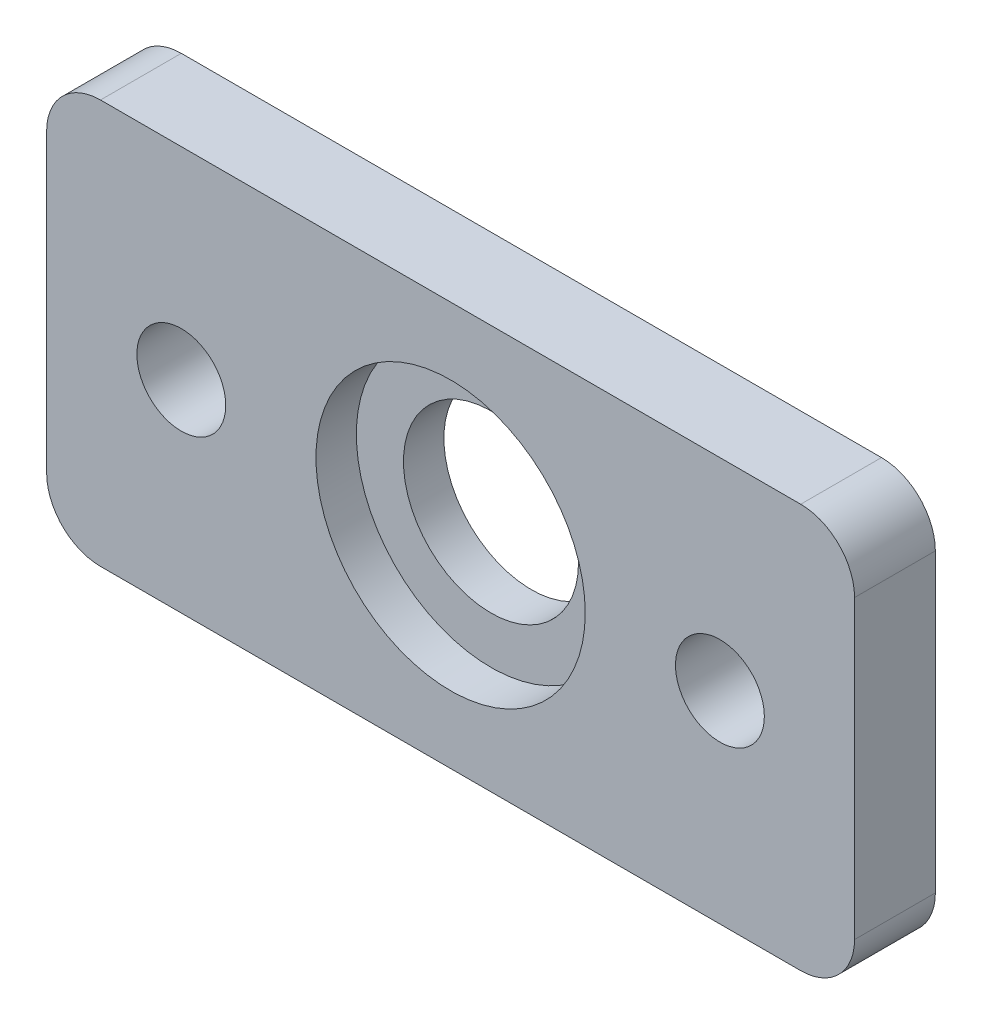
from build123d import *

# Parameters (mm, degrees)
EXTRUDE_1_DEPTH     = 3
SKETCH_2_R          = 5
CUT_EXTRUDE_1_DEPTH = 1.5
SKETCH_3_R          = 3.25
CUT_EXTRUDE_2_DEPTH = 34.674916481
SKETCH_4_R          = 1.65
CUT_EXTRUDE_3_DEPTH = 34.674916481


with BuildPart() as part:
    # Эскиз1 → Бобышка-Вытянуть1 (new body)
    with BuildSketch(Plane.XY):
        with BuildLine():
            Line((2, 0), (28, 0))
            ThreePointArc((28, 0), (29.414213562, 0.585786438), (30, 2))
            Line((30, 2), (30, 13))
            ThreePointArc((30, 13), (29.414213562, 14.414213562), (28, 15))
            Line((28, 15), (2, 15))
            ThreePointArc((2, 15), (0.585786438, 14.414213562), (0, 13))
            Line((0, 13), (0, 2))
            ThreePointArc((0, 2), (0.585786438, 0.585786438), (2, 0))
        make_face()
    extrude(amount=EXTRUDE_1_DEPTH)

    # Эскиз2 → Вырез-Вытянуть1 (cut)
    with BuildSketch(Plane.XY.offset(3)):
        with Locations((15, 7.5)):
            Circle(SKETCH_2_R)
    extrude(amount=-CUT_EXTRUDE_1_DEPTH, mode=Mode.SUBTRACT)

    # Эскиз3 → Вырез-Вытянуть2 (cut, through all)
    with BuildSketch(Plane.XY.offset(3)):
        with Locations((15, 7.5)):
            Circle(SKETCH_3_R)
    extrude(amount=-CUT_EXTRUDE_2_DEPTH, mode=Mode.SUBTRACT)

    # Эскиз4 → Вырез-Вытянуть3 (cut, through all)
    with BuildSketch(Plane.XY.offset(3)):
        with Locations((5, 7.5)):
            Circle(SKETCH_4_R)
        with Locations((25, 7.5)):
            Circle(SKETCH_4_R)
    extrude(amount=-CUT_EXTRUDE_3_DEPTH, mode=Mode.SUBTRACT)


solid = part.part
